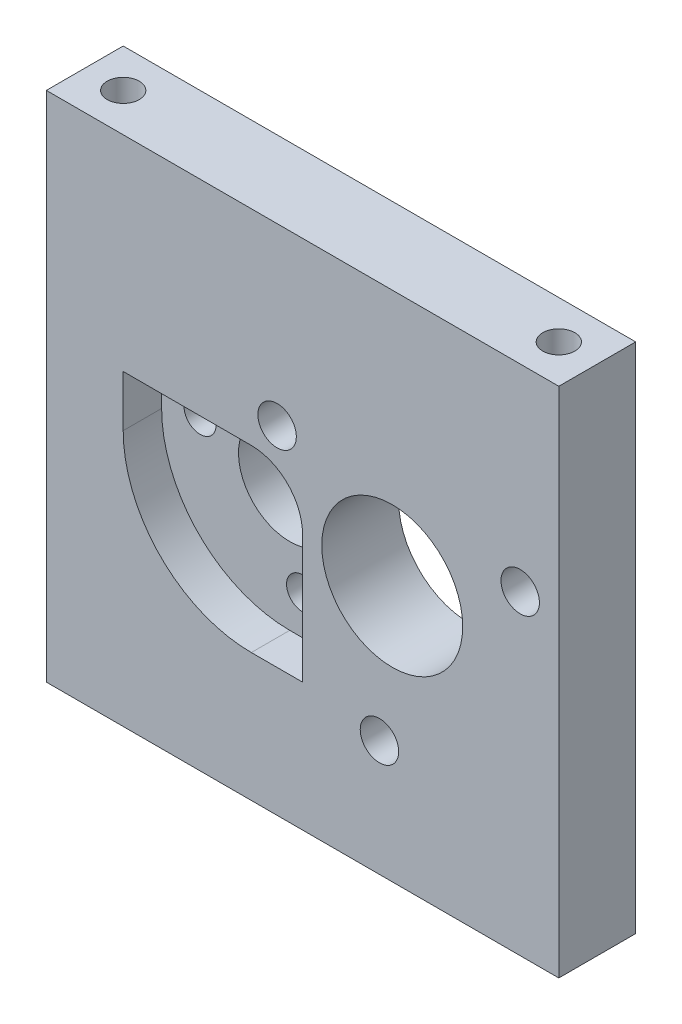
from build123d import *

# Parameters (mm, degrees)
SKETCH1_W          = 40
SKETCH1_H          = 40
EXTRUDE1_DEPTH     = 6
SKETCH8_R          = 5.5
CUT_EXTRUDE6_DEPTH = 6
SKETCH5_R          = 1.5
CUT_EXTRUDE4_DEPTH = 6
CIRPATTERN1_COUNT  = 3
EXTRUDE15_DEPTH    = 3
SKETCH35_R         = 1.25
EXTRUDE17_DEPTH    = 3
SKETCH34_R         = 4
EXTRUDE16_DEPTH    = 3
SKETCH27_R         = 1.25
EXTRUDE6_DEPTH     = 10
EXTRUDE18_START    = -10
SKETCH36_R         = 1.25
EXTRUDE18_DEPTH    = 10


# Read off the part's stored shape, not the designer's step: M3 Tapped Hole1
with BuildPart() as part:
    # Sketch1 → Extrude1 (new body)
    with BuildSketch(Plane.XY):
        with Locations((4, 0)):
            Rectangle(SKETCH1_W, SKETCH1_H)
    extrude(amount=-EXTRUDE1_DEPTH)

    # Sketch8 → Cut-Extrude6 (cut)
    with BuildSketch(Plane(origin=(0, 0, -6), x_dir=(-1, 0, 0), z_dir=(0, 0, -1))):
        with Locations((-11, 0)):
            Circle(SKETCH8_R)
    extrude(amount=-CUT_EXTRUDE6_DEPTH, mode=Mode.SUBTRACT)

    # Sketch5 → Cut-Extrude4 (cut)
    with BuildSketch(Plane(origin=(0, 0, -6), x_dir=(-1, 0, 0), z_dir=(0, 0, -1))):
        with Locations((-10, -10.95445115)):
            Circle(SKETCH5_R)
    cut_extrude4 = extrude(amount=-CUT_EXTRUDE4_DEPTH, mode=Mode.SUBTRACT)

    # CirPattern1: Cut-Extrude4 ×3 about axis
    cirpattern1_axis = Axis((11, 0, 0), (0, 0, 1))
    for i in range(1, CIRPATTERN1_COUNT):
        add(cut_extrude4.rotate(cirpattern1_axis, i * 360 / CIRPATTERN1_COUNT), mode=Mode.SUBTRACT)

    # Sketch29 → Extrude15 (cut)
    with BuildSketch(Plane.XY):
        with BuildLine():
            Line((4, 0), (4, -10))
            Line((4, -10), (0, -10))
            ThreePointArc((0, -10), (-7.071067812, -7.071067812), (-10, 0))
            Line((-10, 0), (-10, 4))
            Line((-10, 4), (0, 4))
            ThreePointArc((0, 4), (2.828427125, 2.828427125), (4, 0))
        make_face()
    extrude(amount=-EXTRUDE15_DEPTH, mode=Mode.SUBTRACT)

    # Sketch35 → Extrude17 (cut)
    with BuildSketch(Plane.XY.offset(-3)):
        with Locations((1, -7)):
            Circle(SKETCH35_R)
        with Locations((-7, 1)):
            Circle(SKETCH35_R)
    extrude(amount=-EXTRUDE17_DEPTH, mode=Mode.SUBTRACT)

    # Sketch34 → Extrude16 (cut)
    with BuildSketch(Plane.XY.offset(-3)):
        Circle(SKETCH34_R)
    extrude(amount=-EXTRUDE16_DEPTH, mode=Mode.SUBTRACT)

    # Sketch27 → Extrude6 (cut)
    with BuildSketch(Plane(origin=(0, 20, 0), x_dir=(1, 0, 0), z_dir=(0, 1, 0))):
        with Locations(Location((-13, 3, 0), (0, 0, 180))):
            Circle(SKETCH27_R)
        with Locations(Location((21, 3, 0), (0, 0, 180))):
            Circle(SKETCH27_R)
    extrude(amount=-EXTRUDE6_DEPTH, mode=Mode.SUBTRACT)

    # Sketch36 → Extrude18 (cut)
    with BuildSketch(Plane.XZ.offset(20).offset(EXTRUDE18_START)):
        with Locations(Location((-13, -3, 0), (0, 0, 180))):
            Circle(SKETCH36_R)
        with Locations(Location((21, -3, 0), (0, 0, 180))):
            Circle(SKETCH36_R)
    extrude(amount=EXTRUDE18_DEPTH, mode=Mode.SUBTRACT)

    # M3 Tapped Hole1 outline → M3 Tapped Hole1 (revolve, cut)
    with BuildSketch(Plane(origin=(21, 0, -3), x_dir=(1, 0, 0), z_dir=(0, 0, 1))):
        Polygon((1.25, -10), (0, -9.248924226), (0, -10), align=None)
        Polygon((0, 10), (0, 9.248924226), (1.25, 10), align=None)
    revolve(axis=Axis((21, 0, -3), (0, 1, 0)), mode=Mode.SUBTRACT)

    # M3 Tapped Hole1 2 outline → M3 Tapped Hole1 2 (revolve, cut)
    with BuildSketch(Plane(origin=(-13, 0, -3), x_dir=(1, 0, 0), z_dir=(0, 0, 1))):
        Polygon((1.25, -10), (0, -9.248924226), (0, -10), align=None)
        Polygon((0, 10), (0, 9.248924226), (1.25, 10), align=None)
    revolve(axis=Axis((-13, 0, -3), (0, 1, 0)), mode=Mode.SUBTRACT)


solid = part.part
